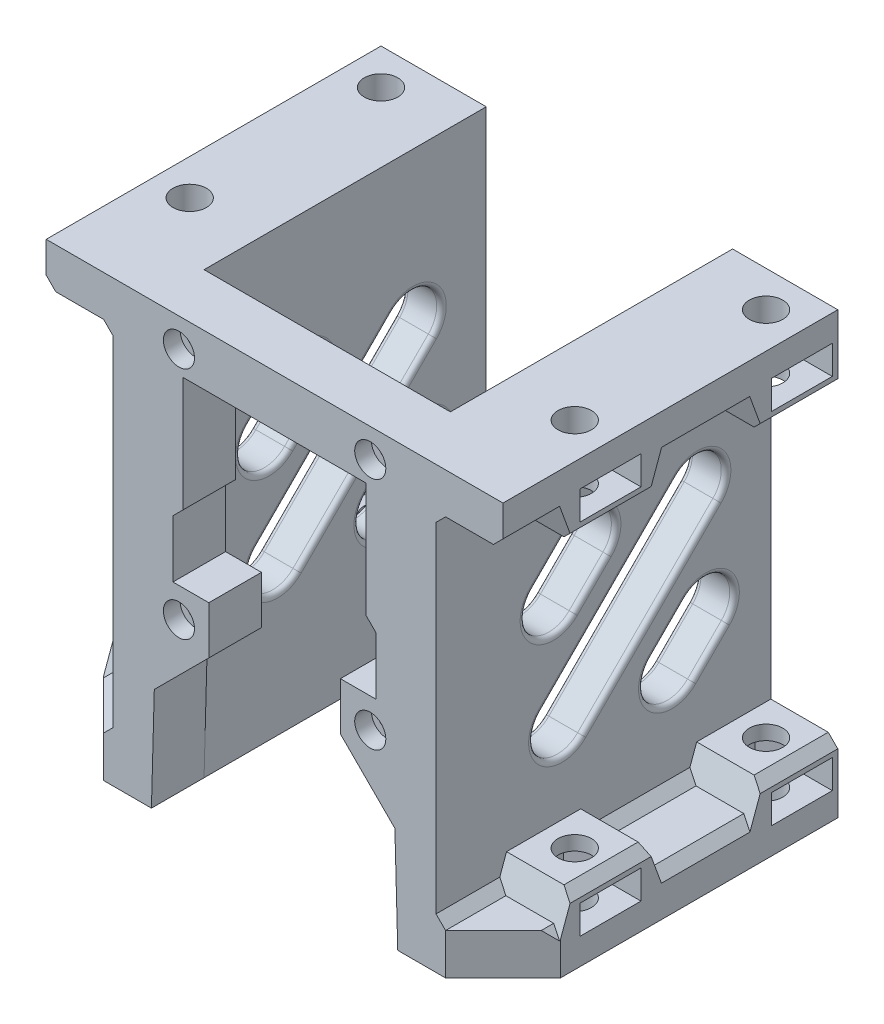
from build123d import *
from build123d.topology import SkipClean

# Parameters (mm, degrees)
BOSS_EXTRUDE1_DEPTH    = 35
SKETCH1_3_R            = 0.875
BOSS_EXTRUDE2_DEPTH    = 5.5
SKETCH1_4_R            = 1.625
CUT_EXTRUDE1_DEPTH     = 1.75
CUT_EXTRUDE2_REACH     = 64.538
SKETCH2_R              = 1.75
CUT_EXTRUDE3_DEPTH     = 4
SKETCH5_W              = 7
SKETCH5_H              = 7.75
SKETCH5_R              = 1.75
BOSS_EXTRUDE3_DEPTH    = 3
CHAMFER2_SIZE          = 1
CUT_EXTRUDE4_DEPTH     = 1.5
CHAMFER5_SIZE          = 1
DRAFT2_ANGLE           = 20
DRAFT3_ANGLE           = 20
MIRROR19_START         = -43.25
MIRROR19_OUTLINE_R     = 1.75
MIRROR19_DEPTH         = 2.55
MIRROR19_START_2       = -40.25
MIRROR19_2_OUTLINE_R   = 1.75
MIRROR19_2_DEPTH       = 0.5
MIRROR19_START_3       = -40.2500001
MIRROR19_3_OUTLINE_W   = 7
MIRROR19_3_OUTLINE_H   = 7.75
MIRROR19_3_OUTLINE_R   = 1.75
MIRROR19_3_DEPTH       = 1.5000001
MIRROR19_START_4       = -41.7
MIRROR19_4_DEPTH       = 1.95
MIRROR19_START_5       = -11.225320151
MIRROR19_5_OUTLINE_W   = 4
MIRROR19_5_OUTLINE_H   = 8.75
MIRROR19_5_OUTLINE_H_2 = 7.75
MIRROR19_5_DEPTH       = 1.225320151
DRAFT4_ANGLE           = 20
DRAFT5_ANGLE           = 20
CHAMFER4_SIZE          = 1
FILLET1_R              = 0.5
CHAMFER6_SIZE          = 6


with BuildPart() as part:
    # Sketch1 → Boss-Extrude1 (new body)
    with BuildSketch(Plane.XY):
        Polygon((23.875, -4.25), (23.875, 0), (12.875, 0), (12.875, -46), (23.875, -46), (23.875, -41.7), (16.875, -41.7), (16.875, -4.25), align=None)
    extrude(amount=-BOSS_EXTRUDE1_DEPTH)

    # Sketch1<3> → Boss-Extrude2 (add)
    with BuildSketch(Plane.XY):
        Polygon((12.875, -46), (12.875, 0), (0, 0), (0, -5.35), (9.575, -5.35), (9.575, -17.35), (10.625, -18.4), (10.625, -24.4), (6.875, -24.4), (6.875, -29.4), (12.575, -35.1), align=None)
        with Locations((10, -3)):
            Circle(SKETCH1_3_R, mode=Mode.SUBTRACT)
        with Locations((10, -27.5)):
            Circle(SKETCH1_3_R, mode=Mode.SUBTRACT)
    extrude(amount=-BOSS_EXTRUDE2_DEPTH)

    # Sketch1<4> → Cut-Extrude1 (cut)
    with BuildSketch(Plane.XY):
        with Locations((10, -3)):
            Circle(SKETCH1_4_R)
        with Locations((10, -27.5)):
            Circle(SKETCH1_4_R)
    extrude(amount=-CUT_EXTRUDE1_DEPTH, mode=Mode.SUBTRACT)

    # Cut-Extrude2: up to this face of the body (flat: up to its plane)
    cut_extrude2_end = Plane(part.part.faces().sort_by_distance((18.375, -46, -17.5))[0])
    # Sketch2 → Cut-Extrude2 (cut, up to the picked face)
    with BuildSketch(Plane(origin=(0, 0, 0), x_dir=(1, 0, 0), z_dir=(0, 1, 0)), mode=Mode.PRIVATE) as cut_extrude2_sk1:
        with Locations(Location((20.125, 31.25, 0), (0, 0, 270))):
            Circle(SKETCH2_R)
    cut_extrude2_tool1 = split(extrude(cut_extrude2_sk1.sketch, amount=-CUT_EXTRUDE2_REACH, mode=Mode.PRIVATE), bisect_by=cut_extrude2_end, keep=Keep.BOTH, mode=Mode.PRIVATE)
    # Sketch2 → Cut-Extrude2 (cut, up to the picked face)
    with BuildSketch(Plane(origin=(0, 0, 0), x_dir=(1, 0, 0), z_dir=(0, 1, 0)), mode=Mode.PRIVATE) as cut_extrude2_sk2:
        with Locations(Location((20.125, 11.25, 0), (0, 0, 270))):
            Circle(SKETCH2_R)
    cut_extrude2_tool2 = split(extrude(cut_extrude2_sk2.sketch, amount=-CUT_EXTRUDE2_REACH, mode=Mode.PRIVATE), bisect_by=cut_extrude2_end, keep=Keep.BOTH, mode=Mode.PRIVATE)
    add(cut_extrude2_tool1.solids().sort_by(Axis((20.125, 0, -31.25), (0, -1, 0)))[0], mode=Mode.SUBTRACT)
    add(cut_extrude2_tool2.solids().sort_by(Axis((20.125, 0, -11.25), (0, -1, 0)))[0], mode=Mode.SUBTRACT)

    # Sketch3 → Cut-Extrude3 (cut)
    with BuildSketch(Plane.ZY.offset(-12.875)):
        with BuildLine():
            Line((-26.083630945, -25.298097039), (-22.548097039, -28.833630945))
            ThreePointArc((-22.548097039, -28.833630945), (-22.548097039, -33.076271632), (-26.790737726, -33.076271632))
            Line((-26.790737726, -33.076271632), (-30.326271632, -29.540737726))
            ThreePointArc((-30.326271632, -29.540737726), (-30.326271632, -25.298097039), (-26.083630945, -25.298097039))
        make_face()
        with BuildLine():
            Line((-25.199747468, -13.807611845), (-11.057611845, -27.949747468))
            ThreePointArc((-11.057611845, -27.949747468), (-11.057611845, -32.192388155), (-15.300252532, -32.192388155))
            Line((-15.300252532, -32.192388155), (-29.442388155, -18.050252532))
            ThreePointArc((-29.442388155, -18.050252532), (-29.442388155, -13.807611845), (-25.199747468, -13.807611845))
        make_face()
        with BuildLine():
            Line((-13.709262274, -12.923728368), (-10.173728368, -16.459262274))
            ThreePointArc((-10.173728368, -16.459262274), (-10.173728368, -20.701902961), (-14.416369055, -20.701902961))
            Line((-14.416369055, -20.701902961), (-17.951902961, -17.166369055))
            ThreePointArc((-17.951902961, -17.166369055), (-17.951902961, -12.923728368), (-13.709262274, -12.923728368))
        make_face()
    extrude(amount=-CUT_EXTRUDE3_DEPTH, mode=Mode.SUBTRACT)

    # Sketch5 → Boss-Extrude3 (add)
    # profile 1 of 2: a face of its own
    with SkipClean():  # the faces are left unmerged after this step: merging them gives an invalid solid
        with BuildSketch(Plane.XZ.offset(4.25)):
            with Locations((20.375, -31.125)):
                Rectangle(SKETCH5_W, SKETCH5_H)
            with Locations((20.125, -31.25)):
                Circle(SKETCH5_R, mode=Mode.SUBTRACT)
        # profile 2 of 2: a face of its own
        with BuildSketch(Plane.XZ.offset(4.25)):
            with Locations((20.375, -11.25)):
                Rectangle(SKETCH5_W, SKETCH5_H)
            with Locations((20.125, -11.25)):
                Circle(SKETCH5_R, mode=Mode.SUBTRACT)
        extrude(amount=BOSS_EXTRUDE3_DEPTH)
    add(part.part.scale(1), mode=Mode.REPLACE)  # the faces are merged on a copy

    # Chamfer2
    chamfer2_edges = [part.edges().sort_by_distance(p)[0] for p in [
        (23.875, -7.25, -31.125),
        (23.875, -7.25, -11.25),
    ]]
    chamfer(chamfer2_edges, length=CHAMFER2_SIZE)

    # Sketch4 → Cut-Extrude4 (cut, symmetric)
    with BuildSketch(Plane(origin=(0, -4.25, 0), x_dir=(1, 0, 0), z_dir=(0, 1, 0))):
        Polygon((17.375, 29.66228676), (20.125, 28.074573519), (22.875, 29.66228676), (22.875, 32.83771324), (20.125, 34.425426481), (17.375, 32.83771324), align=None)
        Polygon((23.875, 34.425426481), (20.125, 34.425426481), (22.875, 32.83771324), (22.875, 29.66228676), (20.125, 28.074573519), (23.875, 28.074573519), align=None)
        Polygon((23.875, 14.425426481), (20.125, 14.425426481), (22.875, 12.83771324), (22.875, 9.66228676), (20.125, 8.074573519), (23.875, 8.074573519), align=None)
        Polygon((22.875, 12.83771324), (20.125, 14.425426481), (17.375, 12.83771324), (17.375, 9.66228676), (20.125, 8.074573519), (22.875, 9.66228676), align=None)
    extrude(amount=CUT_EXTRUDE4_DEPTH, both=True, mode=Mode.SUBTRACT)

    # Chamfer5
    chamfer5_edges = [part.edges().sort_by_distance(p)[0] for p in [
        (16.875, -4.25, -21.1875),
        (16.875, -4.25, -3.6875),
        (16.875, -41.7, -17.5),
    ]]
    chamfer(chamfer5_edges, length=CHAMFER5_SIZE)

    # Draft2
    draft2_faces = [part.faces().sort_by_distance(p)[0] for p in [
        (20.375, -5.75, -15.125),
        (20.375, -5.75, -7.375),
    ]]
    draft(draft2_faces, Plane(origin=(0, -7.25, 0), x_dir=(-1, 0, 0), z_dir=(0, -1, 0)), DRAFT2_ANGLE)

    # Draft3
    draft3_faces = [part.faces().sort_by_distance(p)[0] for p in [
        (20.375, -5.75, -27.25),
    ]]
    draft(draft3_faces, Plane(origin=(0, -7.25, 0), x_dir=(-1, 0, 0), z_dir=(0, -1, 0)), DRAFT3_ANGLE)

    # Mirror19: read off the stored shape, not the designer's step
    # Mirror19 outline → Mirror19 (cut)
    # profile 1 of 2: a face of its own
    with BuildSketch(Plane(origin=(0, 0, 0), x_dir=(1, 0, 0), z_dir=(0, 1, 0)).offset(MIRROR19_START)):
        Polygon((23.875, 8.074573519), (23.875, 14.425426481), (20.125, 14.425426481), (17.375, 12.83771324), (17.375, 9.66228676), (20.125, 8.074573519), align=None)
        with Locations((20.125, 11.25)):
            Circle(MIRROR19_OUTLINE_R, mode=Mode.SUBTRACT)
    # profile 2 of 2: a face of its own
    with BuildSketch(Plane(origin=(0, 0, 0), x_dir=(1, 0, 0), z_dir=(0, 1, 0)).offset(MIRROR19_START)):
        Polygon((20.125, 34.425426481), (17.375, 32.83771324), (17.375, 29.66228676), (20.125, 28.074573519), (23.875, 28.074573519), (23.875, 34.425426481), align=None)
        with Locations((20.125, 31.25)):
            Circle(MIRROR19_OUTLINE_R, mode=Mode.SUBTRACT)
    extrude(amount=MIRROR19_DEPTH, mode=Mode.SUBTRACT)



with BuildPart() as body_2:
    # Mirror19 2 outline → Mirror19 2 (new body)
    # profile 1 of 2: a face of its own
    with BuildSketch(Plane(origin=(0, 0, 0), x_dir=(1, 0, 0), z_dir=(0, 1, 0)).offset(MIRROR19_START_2)):
        Polygon((23.875, 8.074573519), (23.875, 14.425426481), (20.125, 14.425426481), (17.375, 12.83771324), (17.375, 9.66228676), (20.125, 8.074573519), align=None)
        with Locations((20.125, 11.25)):
            Circle(MIRROR19_2_OUTLINE_R, mode=Mode.SUBTRACT)
    # profile 2 of 2: a face of its own
    with BuildSketch(Plane(origin=(0, 0, 0), x_dir=(1, 0, 0), z_dir=(0, 1, 0)).offset(MIRROR19_START_2)):
        Polygon((20.125, 34.425426481), (17.375, 32.83771324), (17.375, 29.66228676), (20.125, 28.074573519), (23.875, 28.074573519), (23.875, 34.425426481), align=None)
        with Locations((20.125, 31.25)):
            Circle(MIRROR19_2_OUTLINE_R, mode=Mode.SUBTRACT)
    extrude(amount=MIRROR19_2_DEPTH)


with BuildPart() as part_1:
    add(part.part)

    add(body_2.part)  # Mirror19 3 merges body 2
    # Mirror19 3 outline → Mirror19 3 (add)
    # profile 1 of 2: a face of its own
    with BuildSketch(Plane(origin=(0, 0, 0), x_dir=(1, 0, 0), z_dir=(0, 1, 0)).offset(MIRROR19_START_3)):
        with Locations((20.375, 31.125)):
            Rectangle(MIRROR19_3_OUTLINE_W, MIRROR19_3_OUTLINE_H)
        with Locations((20.125, 31.25)):
            Circle(MIRROR19_3_OUTLINE_R, mode=Mode.SUBTRACT)
    # profile 2 of 2: a face of its own
    with BuildSketch(Plane(origin=(0, 0, 0), x_dir=(1, 0, 0), z_dir=(0, 1, 0)).offset(MIRROR19_START_3)):
        with Locations((20.375, 11.25)):
            Rectangle(MIRROR19_3_OUTLINE_W, MIRROR19_3_OUTLINE_H)
        with Locations((20.125, 11.25)):
            Circle(MIRROR19_3_OUTLINE_R, mode=Mode.SUBTRACT)
    extrude(amount=MIRROR19_3_DEPTH)

    # Mirror19 4 outline → Mirror19 4 (add)
    with BuildSketch(Plane(origin=(0, 0, 0), x_dir=(1, 0, 0), z_dir=(0, 1, 0)).offset(MIRROR19_START_4)):
        Polygon((23.875, 35), (16.875, 35), (16.875, 27.25), (23.875, 27.25), (23.875, 28.074573519), (20.125, 28.074573519), (17.375, 29.66228676), (17.375, 32.83771324), (20.125, 34.425426481), (23.875, 34.425426481), align=None)
        Polygon((23.875, 15.125), (16.875, 15.125), (16.875, 7.375), (23.875, 7.375), (23.875, 8.074573519), (20.125, 8.074573519), (17.375, 9.66228676), (17.375, 12.83771324), (20.125, 14.425426481), (23.875, 14.425426481), align=None)
    extrude(amount=MIRROR19_4_DEPTH)

    # Mirror19 5 outline → Mirror19 5 (cut)
    with BuildSketch(Plane(origin=(0, 0, 0), x_dir=(0.707106781186545, -0.70710678118655, 0), z_dir=(0.70710678118655, 0.707106781186545, 0)).offset(MIRROR19_START_5)):
        with Locations((44, 31.625)):
            Rectangle(MIRROR19_5_OUTLINE_W, MIRROR19_5_OUTLINE_H)
        with Locations((44, 11.25)):
            Rectangle(MIRROR19_5_OUTLINE_W, MIRROR19_5_OUTLINE_H_2)
    extrude(amount=MIRROR19_5_DEPTH, mode=Mode.SUBTRACT)

    # Draft4
    draft4_faces = [part_1.faces().sort_by_distance(p)[0] for p in [
        (20.375, -40.225, -15.125),
        (20.375, -40.225, -7.375),
    ]]
    draft(draft4_faces, Plane(origin=(0, -38.75, 0), x_dir=(1, 0, 0), z_dir=(0, 1, 0)), DRAFT4_ANGLE)

    # Draft5
    draft5_faces = [part_1.faces().sort_by_distance(p)[0] for p in [
        (20.375, -40.225, -27.25),
    ]]
    draft(draft5_faces, Plane(origin=(0, -38.75, 0), x_dir=(1, 0, 0), z_dir=(0, 1, 0)), DRAFT5_ANGLE)

    # Chamfer4
    chamfer4_edges = [part_1.edges().sort_by_distance(p)[0] for p in [
        (23.875, -4.25, -21.1875),
        (23.875, -4.25, -3.141544649),
        (23.875, -41.7, -21.1875),
        (23.875, -41.7, -3.150643904),
    ]]
    chamfer(chamfer4_edges, length=CHAMFER4_SIZE)

    # Fillet1
    fillet1_edges = [part_1.edges().sort_by_distance(p)[0] for p in [
        (12.875, -13.807611845, -29.442388155),
        (12.875, -25.121320344, -22.371320344),
        (12.875, -32.192388155, -11.057611845),
        (12.875, -20.878679656, -18.128679656),
        (16.875, -13.807611845, -29.442388155),
        (16.875, -20.878679656, -18.128679656),
        (16.875, -32.192388155, -11.057611845),
        (16.875, -25.121320344, -22.371320344),
        (12.875, -12.923728368, -17.951902961),
        (12.875, -18.934136008, -16.184136008),
        (12.875, -20.701902961, -10.173728368),
        (12.875, -14.691495321, -11.941495321),
        (16.875, -12.923728368, -17.951902961),
        (16.875, -14.691495321, -11.941495321),
        (16.875, -20.701902961, -10.173728368),
        (16.875, -18.934136008, -16.184136008),
        (12.875, -25.298097039, -30.326271632),
        (12.875, -31.308504679, -28.558504679),
        (12.875, -33.076271632, -22.548097039),
        (12.875, -27.065863992, -24.315863992),
        (16.875, -25.298097039, -30.326271632),
        (16.875, -27.065863992, -24.315863992),
        (16.875, -33.076271632, -22.548097039),
        (16.875, -31.308504679, -28.558504679),
    ]]
    fillet(fillet1_edges, radius=FILLET1_R)

    # Mirror21: part across plane


with BuildPart() as part_2:
    add(part_1.part)
    add(part_1.part.mirror(Plane(origin=(0, 0, -5.5), x_dir=(0, 0, 1), z_dir=(1, 0, 0))))

    # Chamfer6
    chamfer6_edges = [part_2.edges().sort_by_distance(p)[0] for p in [
        (23.875, -44.35, 0),
        (-23.875, -44.35, 0),
    ]]
    chamfer(chamfer6_edges, length=CHAMFER6_SIZE)


solid = part_2.part
